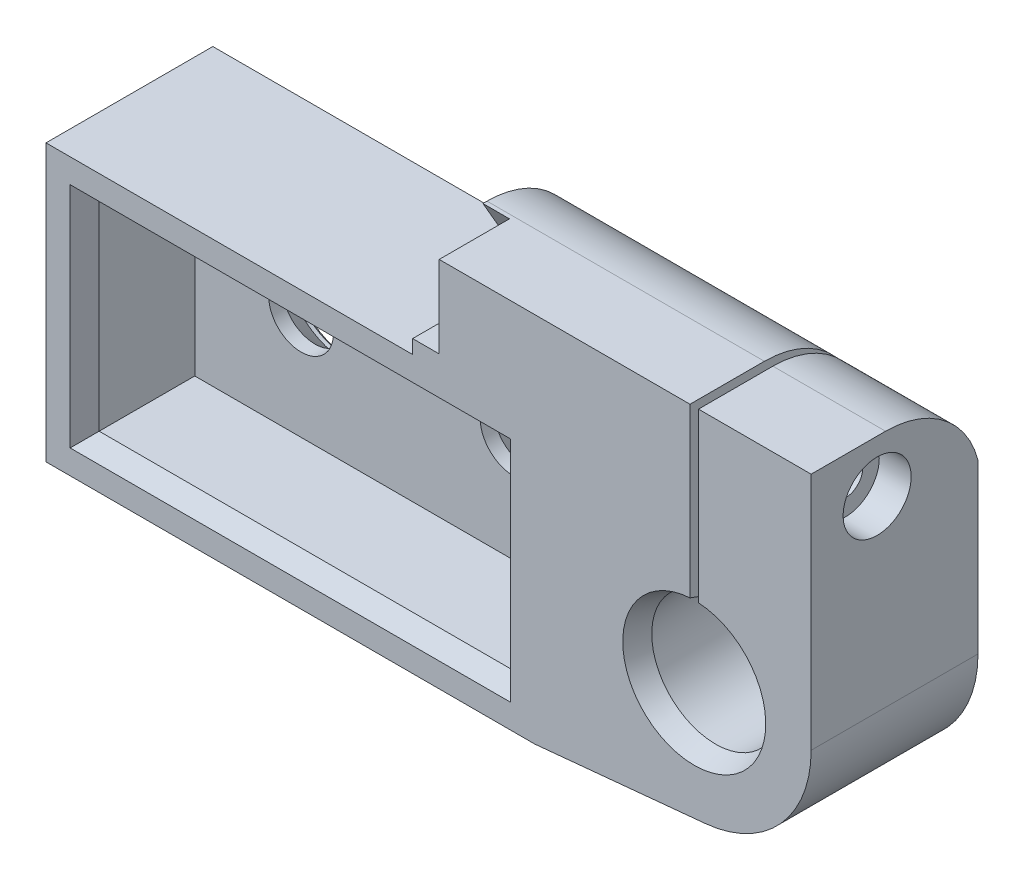
from build123d import *
from OCP.BRepFilletAPI import BRepFilletAPI_MakeChamfer

# Parameters (mm, degrees)
SKETCH1_R           = 2.5
SKETCH1_R_2         = 3.15
BOSS_EXTRUDE1_DEPTH = 16
SKETCH2_W           = 40
SKETCH2_H           = 20
CUT_EXTRUDE1_DEPTH  = 11
FILLET2_R           = 9
SKETCH3_R           = 6
CUT_EXTRUDE2_DEPTH  = 13.5
CUT_EXTRUDE5_DEPTH  = 67.957075802
SKETCH7_R           = 3.05
CUT_EXTRUDE6_DEPTH  = 67.957075802
CHAMFER2_SIZE       = 2
CHAMFER2_SIZE2      = 0.727940469
SKETCH10_R          = 6.1
CUT_EXTRUDE8_DEPTH  = 0.7
CHAMFER3_SIZE       = 3
CHAMFER4_SIZE       = 0.3
SKETCH11_R          = 1.65
CUT_EXTRUDE9_DEPTH  = 78.111931632
SKETCH12_R          = 3.2
CUT_EXTRUDE10_DEPTH = 3
CUT_EXTRUDE11_START = -35
CUT_EXTRUDE11_DEPTH = 43.111931632
CHAMFER5_SIZE       = 2
CHAMFER5_SIZE2      = 0.727940469
CUT_EXTRUDE12_DEPTH = 78.111931632


with BuildPart() as part:
    # Sketch1 → Boss-Extrude1 (new body)
    with BuildSketch(Plane.XY):
        with BuildLine():
            Line((-61, 13.5), (-61, -12.5))
            Line((-61, -12.5), (-15, -12.5))
            Line((-15, -12.5), (1.057538487, -10.949046184))
            ThreePointArc((1.057538487, -10.949046184), (8.143491983, -7.394831866), (11, 0))
            Line((11, 0), (11, 22.5))
            Line((11, 22.5), (-26.5, 22.5))
            Line((-26.5, 22.5), (-26.5, 13.5))
            Line((-26.5, 13.5), (-61, 13.5))
        make_face()
        with Locations((-48, 0.5)):
            Circle(SKETCH1_R, mode=Mode.SUBTRACT)
        with Locations((-28, 0.5)):
            Circle(SKETCH1_R_2, mode=Mode.SUBTRACT)
    extrude(amount=BOSS_EXTRUDE1_DEPTH)

    # Sketch2 → Cut-Extrude1 (cut)
    with BuildSketch(Plane.XY.offset(16)):
        with Locations((-38, 0.5)):
            Rectangle(SKETCH2_W, SKETCH2_H)
    extrude(amount=-CUT_EXTRUDE1_DEPTH, mode=Mode.SUBTRACT)

    # Fillet2
    fillet2_edges = [part.edges().sort_by_distance(p)[0] for p in [
        (-7.75, 22.5, 0),
    ]]
    fillet(fillet2_edges, radius=FILLET2_R)

    # Sketch3 → Cut-Extrude2 (cut)
    with BuildSketch(Plane.XY.offset(16)):
        Circle(SKETCH3_R)
    extrude(amount=-CUT_EXTRUDE2_DEPTH, mode=Mode.SUBTRACT)

    # Sketch6 → Cut-Extrude5 (cut, through all)
    with BuildSketch(Plane.XY.offset(16)):
        with BuildLine():
            Line((-0.4, 24.334661422), (0.4, 24.334661422))
            Line((0.4, 24.334661422), (0.4, 2.973213749))
            ThreePointArc((0.4, 2.973213749), (0, -3), (-0.4, 2.973213749))
            Line((-0.4, 2.973213749), (-0.4, 24.334661422))
        make_face()
    extrude(amount=-CUT_EXTRUDE5_DEPTH, mode=Mode.SUBTRACT)

    # Sketch7 → Cut-Extrude6 (cut, through all)
    with BuildSketch(Plane(origin=(0, 0, 0), x_dir=(-1, 0, 0), z_dir=(0, 0, -1))):
        with Locations((48, 0.5)):
            Circle(SKETCH7_R)
    extrude(amount=-CUT_EXTRUDE6_DEPTH, mode=Mode.SUBTRACT)

    # Chamfer2: one chamfer whose edges measure the first distance from different faces: ONE call of the kernel's chamfer builder (chamfer() names one face for all edges)
    chamfer2_edges_1 = [part.edges().sort_by_distance(p)[0] for p in [
        (-58, 0.5, 16),
    ]]
    chamfer2_side_1 = [part.faces().sort_by_distance(p)[0] for p in [
        (-58, 0.5, 10.5),
    ]]
    chamfer2_edges_2 = [part.edges().sort_by_distance(p)[0] for p in [
        (-38, -9.5, 16),
    ]]
    chamfer2_side_2 = [part.faces().sort_by_distance(p)[0] for p in [
        (-38, -9.5, 10.5),
    ]]
    chamfer2_edges_3 = [part.edges().sort_by_distance(p)[0] for p in [
        (-18, 0.5, 16),
    ]]
    chamfer2_side_3 = [part.faces().sort_by_distance(p)[0] for p in [
        (-18, 0.5, 10.5),
    ]]
    chamfer2_edges_4 = [part.edges().sort_by_distance(p)[0] for p in [
        (-38, 10.5, 16),
    ]]
    chamfer2_side_4 = [part.faces().sort_by_distance(p)[0] for p in [
        (-38, 10.5, 10.5),
    ]]
    chamfer2 = BRepFilletAPI_MakeChamfer(part.part.solid().wrapped)
    for e in chamfer2_edges_1:
        chamfer2.Add(CHAMFER2_SIZE, CHAMFER2_SIZE2, e.wrapped, chamfer2_side_1[0].wrapped)  # the first distance lies on this face
    for e in chamfer2_edges_2:
        chamfer2.Add(CHAMFER2_SIZE, CHAMFER2_SIZE2, e.wrapped, chamfer2_side_2[0].wrapped)  # the first distance lies on this face
    for e in chamfer2_edges_3:
        chamfer2.Add(CHAMFER2_SIZE, CHAMFER2_SIZE2, e.wrapped, chamfer2_side_3[0].wrapped)  # the first distance lies on this face
    for e in chamfer2_edges_4:
        chamfer2.Add(CHAMFER2_SIZE, CHAMFER2_SIZE2, e.wrapped, chamfer2_side_4[0].wrapped)  # the first distance lies on this face
    add(Compound.cast(chamfer2.Shape()), mode=Mode.REPLACE)

    # Sketch10 → Cut-Extrude8 (cut)
    with BuildSketch(Plane(origin=(0, 0, 0), x_dir=(-1, 0, 0), z_dir=(0, 0, -1))):
        with Locations((28, 0.5)):
            Circle(SKETCH10_R)
        with Locations((48, 0.5)):
            Circle(SKETCH10_R)
    extrude(amount=-CUT_EXTRUDE8_DEPTH, mode=Mode.SUBTRACT)

    # Chamfer3
    # the kernel refuses this chamfer: 3 mm, written as the material it takes off along each edge
    with BuildSketch(Plane(origin=(-48, 0.5, 0.7), x_dir=(-1, 0, 0), z_dir=(0, -1, 0))) as chamfer3_piece_1:
        Polygon((3.05, -CHAMFER3_SIZE), (3.05 + CHAMFER3_SIZE, 0), (3.05, 0), align=None)
    revolve(axis=Axis((-48, 0.5, 0.7), (0, 0, -1)), mode=Mode.SUBTRACT)
    with BuildSketch(Plane(origin=(-28, 0.5, 0.7), x_dir=(1, 0, 0), z_dir=(0, 1, 0))) as chamfer3_piece_2_section:
        Polygon((3.15, -CHAMFER3_SIZE), (3.15 + CHAMFER3_SIZE, 0), (3.15, 0), align=None)
    chamfer3_piece_2 = revolve(axis=Axis((-28, 0.5, 0.7), (0, 0, -1)), mode=Mode.PRIVATE)
    chamfer3_piece_2 = chamfer3_piece_2 & Plane(origin=(-28, 0.5, 0.7), x_dir=(-1, 0, 0), z_dir=(0, 0, -1)) * Cylinder(6.1, 25, mode=Mode.PRIVATE)
    add(chamfer3_piece_2, mode=Mode.SUBTRACT)

    # Chamfer4
    # the kernel refuses this chamfer: 0.3 mm, written as the material it takes off along each edge
    with BuildSketch(Plane(origin=(0, 0, 0), x_dir=(-0.0031415874858789867, 0.9999950652018582, 0), z_dir=(0.9999950652018582, 0.0031415874858789867, 0))) as chamfer4_piece_1:
        Polygon((3 + CHAMFER4_SIZE, 0), (3, CHAMFER4_SIZE), (3, 0), align=None)
    revolve(axis=Axis((0, 0, 0), (0, 0, 1)), revolution_arc=359.64, mode=Mode.SUBTRACT)
    with BuildSketch(Plane(origin=(-61, 14.271504896, 0), x_dir=(1, 0, 0), z_dir=(0, -1, 0))) as chamfer4_piece_2:
        Polygon((CHAMFER4_SIZE, 0), (0, CHAMFER4_SIZE), (0, 0), align=None)
    extrude(amount=27.543009793, mode=Mode.SUBTRACT)
    with BuildSketch(Plane(origin=(-61.771504896, -12.5, 0), x_dir=(0, 1, 0), z_dir=(1, 0, 0))) as chamfer4_piece_3:
        Polygon((CHAMFER4_SIZE, 0), (0, CHAMFER4_SIZE), (0, 0), align=None)
    extrude(amount=50.629029378, mode=Mode.SUBTRACT)
    with BuildSketch(Plane(origin=(-18.839655792, -12.870861873, 0), x_dir=(-0.0961398624557926, 0.9953678349469514, 0), z_dir=(0.9953678349469514, 0.09613986245579259, 0))) as chamfer4_piece_4:
        Polygon((CHAMFER4_SIZE, 0), (0, CHAMFER4_SIZE), (0, 0), align=None)
    extrude(amount=19.989790287, mode=Mode.SUBTRACT)
    with BuildSketch(Plane(origin=(0, 0, 0), x_dir=(0.0961398624557928, -0.9953678349469512, 0), z_dir=(-0.9953678349469512, -0.0961398624557928, 0))) as chamfer4_piece_5:
        Polygon((11 - CHAMFER4_SIZE, 0), (11, CHAMFER4_SIZE), (11, 0), align=None)
    revolve(axis=Axis((0, 0, 0), (0, 0, 1)), revolution_arc=84.483070562, mode=Mode.SUBTRACT)
    with BuildSketch(Plane(origin=(-28, 0.5, 0), x_dir=(-1, 0, 0), z_dir=(0, -1, 0))) as chamfer4_piece_6:
        Polygon((6.1 + CHAMFER4_SIZE, 0), (6.1, -CHAMFER4_SIZE), (6.1, 0), align=None)
    revolve(axis=Axis((-28, 0.5, 0), (0, 0, -1)), mode=Mode.SUBTRACT)
    with BuildSketch(Plane(origin=(-48, 0.5, 0), x_dir=(-1, 0, 0), z_dir=(0, -1, 0))) as chamfer4_piece_7:
        Polygon((6.1 + CHAMFER4_SIZE, 0), (6.1, -CHAMFER4_SIZE), (6.1, 0), align=None)
    revolve(axis=Axis((-48, 0.5, 0), (0, 0, -1)), mode=Mode.SUBTRACT)
    with BuildSketch(Plane(origin=(0.4, 17.357524482, 0), x_dir=(1, 0, 0), z_dir=(0, -1, 0)), Plane(origin=(-0.4, 2.201708853, 0), x_dir=(-1, 0, 0), z_dir=(0, 1, 0))) as chamfer4_piece_8:
        Polygon((CHAMFER4_SIZE, 0), (0, CHAMFER4_SIZE), (0, 0), align=None)
    extrude(amount=15.155815629, mode=Mode.SUBTRACT)
    with BuildSketch(Plane(origin=(11, 0, 0), x_dir=(0, 0, 1), z_dir=(0, 1, 0))) as chamfer4_piece_9:
        Polygon((CHAMFER4_SIZE, 0), (0, -CHAMFER4_SIZE), (0, 0), align=None)
    extrude(amount=17.357524482, mode=Mode.SUBTRACT)
    with BuildSketch(Plane(origin=(-26.5, 13.5, 0), x_dir=(0, -1, 0), z_dir=(-1, 0, 0))) as chamfer4_piece_10:
        Polygon((CHAMFER4_SIZE, 0), (0, CHAMFER4_SIZE), (0, 0), align=None)
    extrude(amount=35.271504896, mode=Mode.SUBTRACT)

    # Sketch11 → Cut-Extrude9 (cut, through all)
    with BuildSketch(Plane(origin=(11, 0, 0), x_dir=(0, 0, -1), z_dir=(1, 0, 0))):
        with Locations((-9.790309274, 17.6)):
            Circle(SKETCH11_R)
    extrude(amount=-CUT_EXTRUDE9_DEPTH, mode=Mode.SUBTRACT)

    # Sketch12 → Cut-Extrude10 (cut)
    with BuildSketch(Plane(origin=(11, 0, 0), x_dir=(0, 0, -1), z_dir=(1, 0, 0))):
        with Locations((-9.790309274, 17.6)):
            Circle(SKETCH12_R)
    extrude(amount=-CUT_EXTRUDE10_DEPTH, mode=Mode.SUBTRACT)

    # Sketch13 → Cut-Extrude11 (cut, through all)
    with BuildSketch(Plane(origin=(11, 0, 0), x_dir=(0, 0, -1), z_dir=(1, 0, 0)).offset(CUT_EXTRUDE11_START)):
        Polygon((-9.386164085, 22.5), (-16, 22.5), (-16, 14.8), (-8.17372852, 14.8), (-6.557147766, 17.6), align=None)
    extrude(amount=-CUT_EXTRUDE11_DEPTH, mode=Mode.SUBTRACT)

    # Chamfer5
    chamfer5_edges = [part.edges().sort_by_distance(p)[0] for p in [
        (-4.098780306, -4.38178046, 16),
    ]]
    chamfer5_side = [part.faces().sort_by_distance(p)[0] for p in [
        (-4.098780306, -4.38178046, 9.25),
    ]]
    chamfer(chamfer5_edges, length=CHAMFER5_SIZE, length2=CHAMFER5_SIZE2, reference=chamfer5_side[0])

    # Sketch14 → Cut-Extrude12 (cut, through all)
    with BuildSketch(Plane(origin=(11, 0, 0), x_dir=(0, 0, -1), z_dir=(1, 0, 0))):
        Polygon((-9.790309274, 17.6), (-10.957035463, 18.766726189), (-11.760309274, 17.963452378), (-11.760309274, 17.236547622), (-10.957035463, 16.433273811), align=None)
    extrude(amount=-CUT_EXTRUDE12_DEPTH, mode=Mode.SUBTRACT)


solid = part.part
